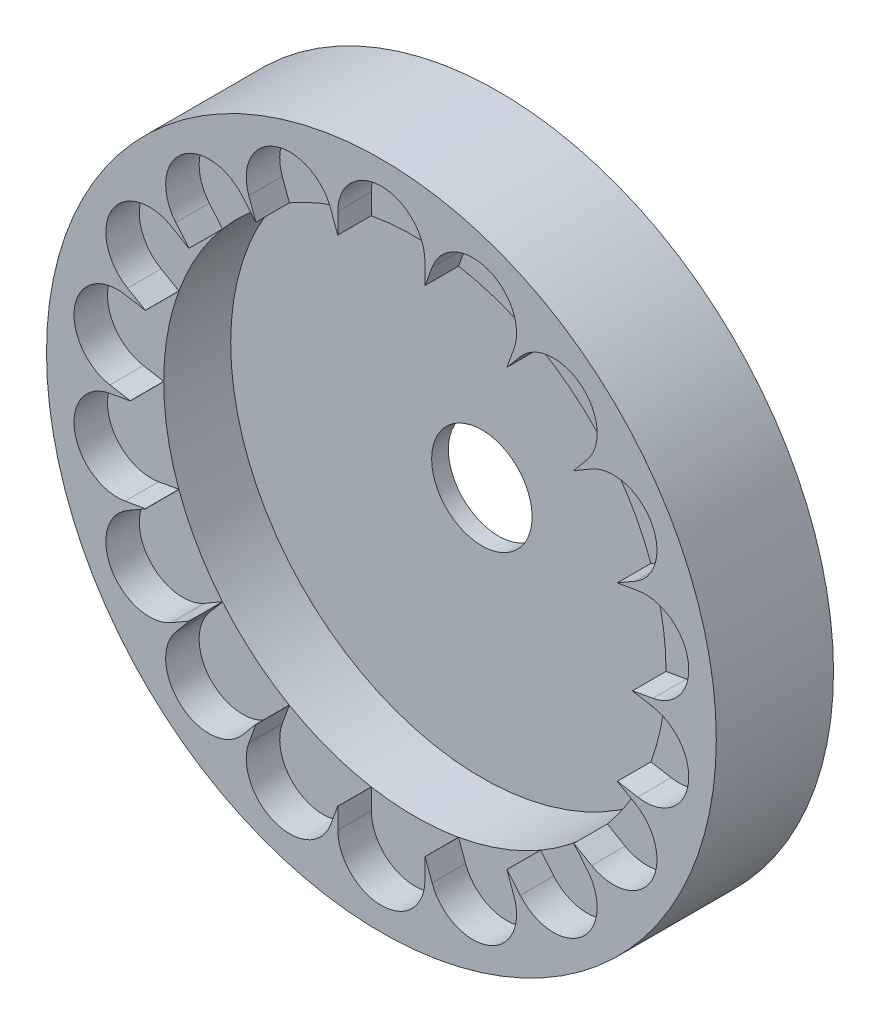
from build123d import *

# Parameters (mm, degrees)
SKETCH1_R           = 63.5
SKETCH1_R_2         = 47.625
BOSS_EXTRUDE1_DEPTH = 19.05
CUT_EXTRUDE1_DEPTH  = 6.35
CIRPATTERN1_COUNT   = 10
CIRPATTERN1_ANGLE   = 180
BOSS_EXTRUDE2_START = 3.175
SKETCH3_R           = 63.5
SKETCH3_R_2         = 9.525
BOSS_EXTRUDE2_DEPTH = 3.175


with BuildPart() as part:
    # Sketch1 → Boss-Extrude1 (new body)
    with BuildSketch(Plane.XY):
        Circle(SKETCH1_R)
        Circle(SKETCH1_R_2, mode=Mode.SUBTRACT)
    extrude(amount=BOSS_EXTRUDE1_DEPTH)

    # Sketch2 → Cut-Extrude1 (cut)
    with BuildSketch(Plane.XY.offset(19.05)):
        with BuildLine():
            Line((8.255, 50.8), (8.255, -50.8))
            ThreePointArc((8.255, -50.8), (0, -59.055), (-8.255, -50.8))
            Line((-8.255, -50.8), (-8.255, 50.8))
            ThreePointArc((-8.255, 50.8), (0, 59.055), (8.255, 50.8))
        make_face()
    cut_extrude1 = extrude(amount=-CUT_EXTRUDE1_DEPTH, mode=Mode.SUBTRACT)

    # CirPattern1: Cut-Extrude1 ×10 about axis
    cirpattern1_axis = Axis((0, 0, 19.05), (0, 0, 1))
    for i in range(1, CIRPATTERN1_COUNT):
        add(cut_extrude1.rotate(cirpattern1_axis, i * CIRPATTERN1_ANGLE / (CIRPATTERN1_COUNT - 1)), mode=Mode.SUBTRACT)

    # Sketch3 → Boss-Extrude2 (add)
    with BuildSketch(Plane(origin=(0, 0, 0), x_dir=(-1, 0, 0), z_dir=(0, 0, -1)).offset(BOSS_EXTRUDE2_START)):
        Circle(SKETCH3_R)
        Circle(SKETCH3_R_2, mode=Mode.SUBTRACT)
    extrude(amount=-BOSS_EXTRUDE2_DEPTH)


solid = part.part
